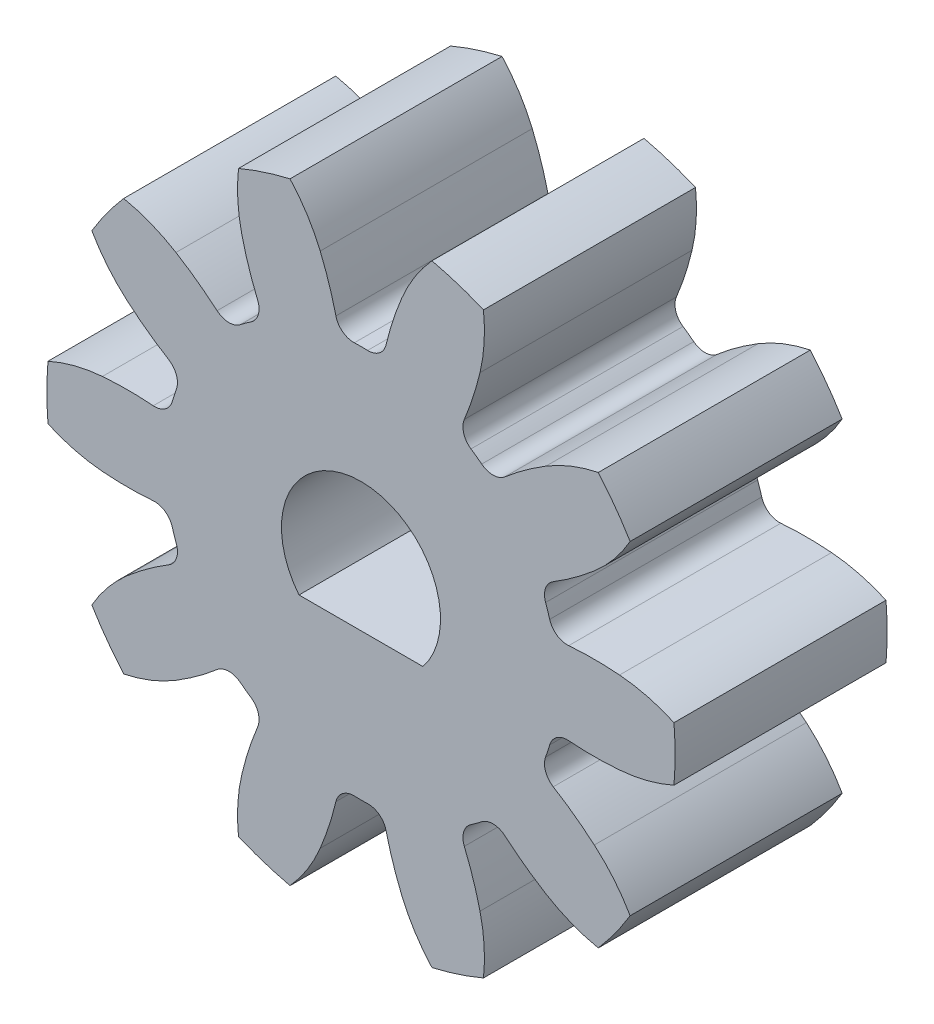
from build123d import *

# Parameters (mm, degrees)
SKETCH1_R                = 5.926666667
BLANK_DISK_DEPTH         = 2.000000064
GEAR_TOOTH_CUT_DEPTH     = 10.287128543
GEAR_TEETH_REVOLVE_COUNT = 10
SKETCH4_R                = 0.75
HUB_EXTRUDE_DEPTH        = 0.635
HEX_BORE_CUT_DEPTH       = 10.19015236
HEX_BORE_CUT_DEPTH_BACK  = 10.19015236


with BuildPart() as part:
    # Sketch1 → BLANK DISK (new, symmetric)
    with BuildSketch(Plane.XY):
        Circle(SKETCH1_R)
    extrude(amount=BLANK_DISK_DEPTH, both=True)

    # Sketch2 → GEAR TOOTH CUT (cut, through all)
    with BuildSketch(Plane.XY.offset(2.000000064)):
        with BuildLine():
            ThreePointArc((-5.077291995, -3.057201951), (-5.636594953, -1.83144072), (-5.90459373, -0.511029022))
            ThreePointArc((-5.90459373, -0.511029022), (-5.402476049, -0.687662082), (-4.877561226, -0.775899444))
            ThreePointArc((-4.877561226, -0.775899444), (-4.39839721, -0.795349357), (-3.919215726, -0.776334691))
            ThreePointArc((-3.919215726, -0.776334691), (-3.694949803, -0.83665634), (-3.55944947, -1.025265898))
            ThreePointArc((-3.55944947, -1.025265898), (-3.522871846, -1.14465045), (-3.482291287, -1.26273437))
            ThreePointArc((-3.482291287, -1.26273437), (-3.481051441, -1.494967805), (-3.627030209, -1.675589246))
            ThreePointArc((-3.627030209, -1.675589246), (-4.025872713, -1.941861868), (-4.402092173, -2.239242719))
            ThreePointArc((-4.402092173, -2.239242719), (-4.774892565, -2.619165437), (-5.077291995, -3.057201951))
        make_face()
    gear_tooth_cut = extrude(amount=-GEAR_TOOTH_CUT_DEPTH, mode=Mode.SUBTRACT)

    # GEAR TEETH REVOLVE: GEAR TOOTH CUT ×10 about axis
    gear_teeth_revolve_axis = Axis((0, 0, 50), (0, 0, -1))
    for i in range(1, GEAR_TEETH_REVOLVE_COUNT):
        add(gear_tooth_cut.rotate(gear_teeth_revolve_axis, i * 360 / GEAR_TEETH_REVOLVE_COUNT), mode=Mode.SUBTRACT)

    # Sketch4 → Hub Extrude (add)
    with BuildSketch(Plane.XY.offset(2.000000064)):
        Circle(SKETCH4_R)
    extrude(amount=HUB_EXTRUDE_DEPTH)

    # Sketch3 → HEX BORE CUT (cut, two sides: drawn at the far end of the back side and taken through both)
    with BuildSketch(Plane.XY.offset(2.000000064).offset(-HEX_BORE_CUT_DEPTH_BACK)):
        with BuildLine():
            Line((-1.168931136, -0.94), (1.168931136, -0.94))
            ThreePointArc((1.168931136, -0.94), (0, 1.5), (-1.168931136, -0.94))
        make_face()
    extrude(amount=HEX_BORE_CUT_DEPTH + HEX_BORE_CUT_DEPTH_BACK, mode=Mode.SUBTRACT)


solid = part.part
